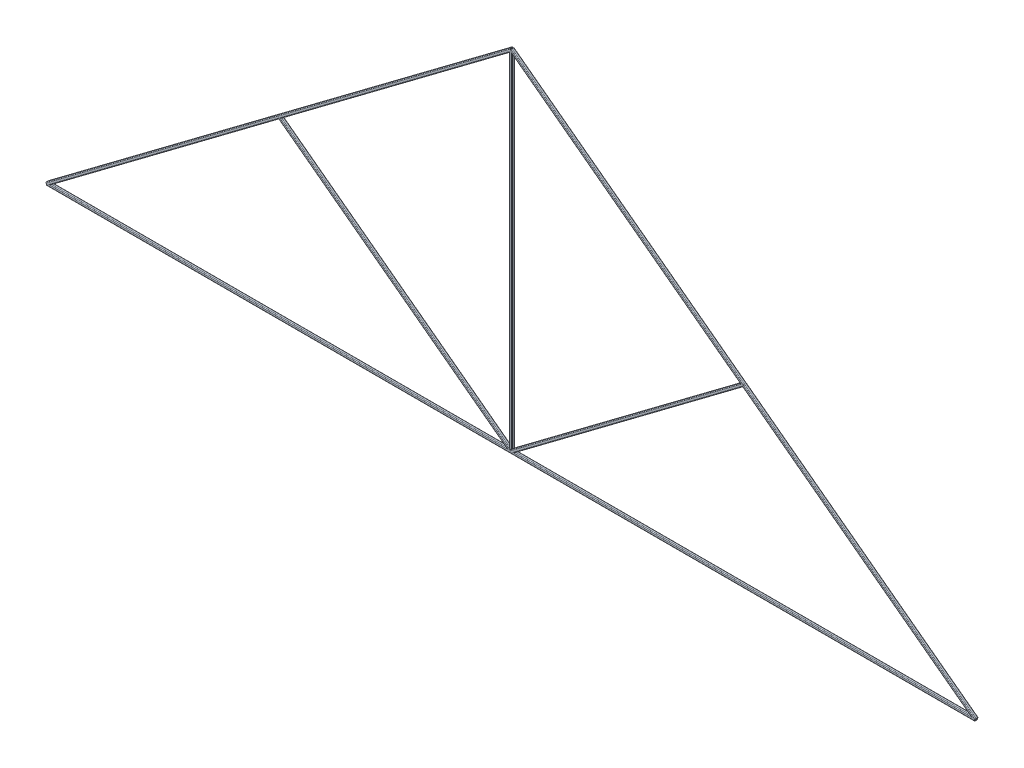
from build123d import *

# Parameters (mm, degrees)
STRUCTURAL_MEMBER1_DEPTH   = 5000
STRUCTURAL_MEMBER1_2_DEPTH = 5000
STRUCTURAL_MEMBER1_3_DEPTH = 5000
STRUCTURAL_MEMBER1_4_DEPTH = 5000
STRUCTURAL_MEMBER1_5_DEPTH = 8000
STRUCTURAL_MEMBER1_6_DEPTH = 8000
STRUCTURAL_START           = 31.75
STRUCTURAL_MEMBER2_DEPTH   = 5968.25
STRUCTURAL_START_2         = -26
STRUCTURAL_MEMBER2_2_DEPTH = 52
STRUCTURAL_START_3         = 6400
STRUCTURAL_MEMBER2_3_DEPTH = 5000
STRUCTURAL_START_4         = 1400
STRUCTURAL_MEMBER2_4_DEPTH = 5000


with BuildPart() as part:
    # Sketch12 → Structural Member1 (new body)
    with BuildSketch(Plane(origin=(0, 0, 0), x_dir=(-0.6000000000000001, 0.7999999999999999, 0), z_dir=(0.7999999999999999, 0.6000000000000001, 0))):
        with BuildLine():
            Line((-12.7, -25.4), (12.7, -25.4))
            ThreePointArc((12.7, -25.4), (21.680256121, -21.680256121), (25.4, -12.7))
            Line((25.4, -12.7), (25.4, 12.7))
            ThreePointArc((25.4, 12.7), (21.680256121, 21.680256121), (12.7, 25.4))
            Line((12.7, 25.4), (-12.7, 25.4))
            ThreePointArc((-12.7, 25.4), (-21.680256121, 21.680256121), (-25.4, 12.7))
            Line((-25.4, 12.7), (-25.4, -12.7))
            ThreePointArc((-25.4, -12.7), (-21.680256121, -21.680256121), (-12.7, -25.4))
        make_face()
        with BuildLine():
            Line((-12.7, -19.05), (12.7, -19.05))
            ThreePointArc((12.7, -19.05), (17.190128061, -17.190128061), (19.05, -12.7))
            Line((19.05, -12.7), (19.05, 12.7))
            ThreePointArc((19.05, 12.7), (17.190128061, 17.190128061), (12.7, 19.05))
            Line((12.7, 19.05), (-12.7, 19.05))
            ThreePointArc((-12.7, 19.05), (-17.190128061, 17.190128061), (-19.05, 12.7))
            Line((-19.05, 12.7), (-19.05, -12.7))
            ThreePointArc((-19.05, -12.7), (-17.190128061, -17.190128061), (-12.7, -19.05))
        make_face(mode=Mode.SUBTRACT)
    extrude(amount=STRUCTURAL_MEMBER1_DEPTH)


with BuildPart() as body_2:
    # Sketch12 on segment 2 (carried to segment 2) → Structural Member1 2 (new body)
    with BuildSketch(Plane(origin=(4000, 3000, 0), x_dir=(-0.6, 0.8, 0), z_dir=(0.8, 0.6, 0))):
        with BuildLine():
            Line((-12.7, -25.4), (12.7, -25.4))
            ThreePointArc((12.7, -25.4), (21.680256121, -21.680256121), (25.4, -12.7))
            Line((25.4, -12.7), (25.4, 12.7))
            ThreePointArc((25.4, 12.7), (21.680256121, 21.680256121), (12.7, 25.4))
            Line((12.7, 25.4), (-12.7, 25.4))
            ThreePointArc((-12.7, 25.4), (-21.680256121, 21.680256121), (-25.4, 12.7))
            Line((-25.4, 12.7), (-25.4, -12.7))
            ThreePointArc((-25.4, -12.7), (-21.680256121, -21.680256121), (-12.7, -25.4))
        make_face()
        with BuildLine():
            Line((-12.7, -19.05), (12.7, -19.05))
            ThreePointArc((12.7, -19.05), (17.190128061, -17.190128061), (19.05, -12.7))
            Line((19.05, -12.7), (19.05, 12.7))
            ThreePointArc((19.05, 12.7), (17.190128061, 17.190128061), (12.7, 19.05))
            Line((12.7, 19.05), (-12.7, 19.05))
            ThreePointArc((-12.7, 19.05), (-17.190128061, 17.190128061), (-19.05, 12.7))
            Line((-19.05, 12.7), (-19.05, -12.7))
            ThreePointArc((-19.05, -12.7), (-17.190128061, -17.190128061), (-12.7, -19.05))
        make_face(mode=Mode.SUBTRACT)
    extrude(amount=STRUCTURAL_MEMBER1_2_DEPTH)


with BuildPart() as body_3:
    # Sketch12 on segment 3 (carried to segment 3) → Structural Member1 3 (new body)
    with BuildSketch(Plane(origin=(8000, 6000, 0), x_dir=(0.6, 0.8, 0), z_dir=(0.8, -0.6, 0))):
        with BuildLine():
            Line((-12.7, -25.4), (12.7, -25.4))
            ThreePointArc((12.7, -25.4), (21.680256121, -21.680256121), (25.4, -12.7))
            Line((25.4, -12.7), (25.4, 12.7))
            ThreePointArc((25.4, 12.7), (21.680256121, 21.680256121), (12.7, 25.4))
            Line((12.7, 25.4), (-12.7, 25.4))
            ThreePointArc((-12.7, 25.4), (-21.680256121, 21.680256121), (-25.4, 12.7))
            Line((-25.4, 12.7), (-25.4, -12.7))
            ThreePointArc((-25.4, -12.7), (-21.680256121, -21.680256121), (-12.7, -25.4))
        make_face()
        with BuildLine():
            Line((-12.7, -19.05), (12.7, -19.05))
            ThreePointArc((12.7, -19.05), (17.190128061, -17.190128061), (19.05, -12.7))
            Line((19.05, -12.7), (19.05, 12.7))
            ThreePointArc((19.05, 12.7), (17.190128061, 17.190128061), (12.7, 19.05))
            Line((12.7, 19.05), (-12.7, 19.05))
            ThreePointArc((-12.7, 19.05), (-17.190128061, 17.190128061), (-19.05, 12.7))
            Line((-19.05, 12.7), (-19.05, -12.7))
            ThreePointArc((-19.05, -12.7), (-17.190128061, -17.190128061), (-12.7, -19.05))
        make_face(mode=Mode.SUBTRACT)
    extrude(amount=STRUCTURAL_MEMBER1_3_DEPTH)


with BuildPart() as body_4:
    # Sketch12 on segment 4 (carried to segment 4) → Structural Member1 4 (new body)
    with BuildSketch(Plane(origin=(12000, 3000, 0), x_dir=(0.6, 0.8, 0), z_dir=(0.8, -0.6, 0))):
        with BuildLine():
            Line((-12.7, -25.4), (12.7, -25.4))
            ThreePointArc((12.7, -25.4), (21.680256121, -21.680256121), (25.4, -12.7))
            Line((25.4, -12.7), (25.4, 12.7))
            ThreePointArc((25.4, 12.7), (21.680256121, 21.680256121), (12.7, 25.4))
            Line((12.7, 25.4), (-12.7, 25.4))
            ThreePointArc((-12.7, 25.4), (-21.680256121, 21.680256121), (-25.4, 12.7))
            Line((-25.4, 12.7), (-25.4, -12.7))
            ThreePointArc((-25.4, -12.7), (-21.680256121, -21.680256121), (-12.7, -25.4))
        make_face()
        with BuildLine():
            Line((-12.7, -19.05), (12.7, -19.05))
            ThreePointArc((12.7, -19.05), (17.190128061, -17.190128061), (19.05, -12.7))
            Line((19.05, -12.7), (19.05, 12.7))
            ThreePointArc((19.05, 12.7), (17.190128061, 17.190128061), (12.7, 19.05))
            Line((12.7, 19.05), (-12.7, 19.05))
            ThreePointArc((-12.7, 19.05), (-17.190128061, 17.190128061), (-19.05, 12.7))
            Line((-19.05, 12.7), (-19.05, -12.7))
            ThreePointArc((-19.05, -12.7), (-17.190128061, -17.190128061), (-12.7, -19.05))
        make_face(mode=Mode.SUBTRACT)
    extrude(amount=STRUCTURAL_MEMBER1_4_DEPTH)


with BuildPart() as body_5:
    # Sketch12 on segment 5 (carried to segment 5) → Structural Member1 5 (new body)
    with BuildSketch(Plane(origin=(16000, 0, 0), x_dir=(0, -1, 0), z_dir=(-1, 0, 0))):
        with BuildLine():
            Line((-12.7, -25.4), (12.7, -25.4))
            ThreePointArc((12.7, -25.4), (21.680256121, -21.680256121), (25.4, -12.7))
            Line((25.4, -12.7), (25.4, 12.7))
            ThreePointArc((25.4, 12.7), (21.680256121, 21.680256121), (12.7, 25.4))
            Line((12.7, 25.4), (-12.7, 25.4))
            ThreePointArc((-12.7, 25.4), (-21.680256121, 21.680256121), (-25.4, 12.7))
            Line((-25.4, 12.7), (-25.4, -12.7))
            ThreePointArc((-25.4, -12.7), (-21.680256121, -21.680256121), (-12.7, -25.4))
        make_face()
        with BuildLine():
            Line((-12.7, -19.05), (12.7, -19.05))
            ThreePointArc((12.7, -19.05), (17.190128061, -17.190128061), (19.05, -12.7))
            Line((19.05, -12.7), (19.05, 12.7))
            ThreePointArc((19.05, 12.7), (17.190128061, 17.190128061), (12.7, 19.05))
            Line((12.7, 19.05), (-12.7, 19.05))
            ThreePointArc((-12.7, 19.05), (-17.190128061, 17.190128061), (-19.05, 12.7))
            Line((-19.05, 12.7), (-19.05, -12.7))
            ThreePointArc((-19.05, -12.7), (-17.190128061, -17.190128061), (-12.7, -19.05))
        make_face(mode=Mode.SUBTRACT)
    extrude(amount=STRUCTURAL_MEMBER1_5_DEPTH)


with BuildPart() as body_6:
    # Sketch12 on segment 6 (carried to segment 6) → Structural Member1 6 (new body)
    with BuildSketch(Plane(origin=(8000, 0, 0), x_dir=(0, -1, 0), z_dir=(-1, 0, 0))):
        with BuildLine():
            Line((-12.7, -25.4), (12.7, -25.4))
            ThreePointArc((12.7, -25.4), (21.680256121, -21.680256121), (25.4, -12.7))
            Line((25.4, -12.7), (25.4, 12.7))
            ThreePointArc((25.4, 12.7), (21.680256121, 21.680256121), (12.7, 25.4))
            Line((12.7, 25.4), (-12.7, 25.4))
            ThreePointArc((-12.7, 25.4), (-21.680256121, 21.680256121), (-25.4, 12.7))
            Line((-25.4, 12.7), (-25.4, -12.7))
            ThreePointArc((-25.4, -12.7), (-21.680256121, -21.680256121), (-12.7, -25.4))
        make_face()
        with BuildLine():
            Line((-12.7, -19.05), (12.7, -19.05))
            ThreePointArc((12.7, -19.05), (17.190128061, -17.190128061), (19.05, -12.7))
            Line((19.05, -12.7), (19.05, 12.7))
            ThreePointArc((19.05, 12.7), (17.190128061, 17.190128061), (12.7, 19.05))
            Line((12.7, 19.05), (-12.7, 19.05))
            ThreePointArc((-12.7, 19.05), (-17.190128061, 17.190128061), (-19.05, 12.7))
            Line((-19.05, 12.7), (-19.05, -12.7))
            ThreePointArc((-19.05, -12.7), (-17.190128061, -17.190128061), (-12.7, -19.05))
        make_face(mode=Mode.SUBTRACT)
    extrude(amount=STRUCTURAL_MEMBER1_6_DEPTH)


with BuildPart() as body_7:
    # Structural Member2: read off the stored shape, not the designer's step
    # Structural Member2 outline → Structural Member2 (new body)
    with BuildSketch(Plane(origin=(0, 0, 0), x_dir=(1, 0, 0), z_dir=(0, 1, 0)).offset(STRUCTURAL_START)):
        with BuildLine():
            Line((7974.6, 12.7), (7974.6, -12.7))
            ThreePointArc((7974.6, -12.7), (7978.319743879, -21.680256121), (7987.3, -25.4))
            Line((7987.3, -25.4), (8012.7, -25.4))
            ThreePointArc((8012.7, -25.4), (8021.680256121, -21.680256121), (8025.4, -12.7))
            Line((8025.4, -12.7), (8025.4, 12.7))
            ThreePointArc((8025.4, 12.7), (8021.680256121, 21.680256121), (8012.7, 25.4))
            Line((8012.7, 25.4), (7987.3, 25.4))
            ThreePointArc((7987.3, 25.4), (7978.319743879, 21.680256121), (7974.6, 12.7))
        make_face()
        with BuildLine():
            ThreePointArc((8012.7, 19.05), (8017.190128061, 17.190128061), (8019.05, 12.7))
            Line((8019.05, 12.7), (8019.05, -12.7))
            ThreePointArc((8019.05, -12.7), (8017.190128061, -17.190128061), (8012.7, -19.05))
            Line((8012.7, -19.05), (7987.3, -19.05))
            ThreePointArc((7987.3, -19.05), (7982.809871939, -17.190128061), (7980.95, -12.7))
            Line((7980.95, -12.7), (7980.95, 12.7))
            ThreePointArc((7980.95, 12.7), (7982.809871939, 17.190128061), (7987.3, 19.05))
            Line((7987.3, 19.05), (8012.7, 19.05))
        make_face(mode=Mode.SUBTRACT)
    extrude(amount=STRUCTURAL_MEMBER2_DEPTH)

    # Structural Member2 2 outline → Structural Member2 2 (cut)
    with BuildSketch(Plane.XY.offset(STRUCTURAL_START_2)):
        Polygon((8000, 31.75), (8025.4, 31.75), (8025.4, 50.8), align=None)
        Polygon((7974.6, 50.8), (7974.6, 31.75), (8000, 31.75), align=None)
    extrude(amount=STRUCTURAL_MEMBER2_2_DEPTH, mode=Mode.SUBTRACT)


with BuildPart() as body_8:
    # Structural Member2 3 outline → Structural Member2 3 (new body)
    with BuildSketch(Plane(origin=(0, 0, 0), x_dir=(0.6, -0.8000000000000002, 0), z_dir=(0.8, 0.6, 0)).offset(STRUCTURAL_START_3)):
        with BuildLine():
            ThreePointArc((4774.6, -12.7), (4778.319743879, -21.680256121), (4787.3, -25.4))
            Line((4787.3, -25.4), (4812.7, -25.4))
            ThreePointArc((4812.7, -25.4), (4821.680256121, -21.680256121), (4825.4, -12.7))
            Line((4825.4, -12.7), (4825.4, 12.7))
            ThreePointArc((4825.4, 12.7), (4821.680256121, 21.680256121), (4812.7, 25.4))
            Line((4812.7, 25.4), (4787.3, 25.4))
            ThreePointArc((4787.3, 25.4), (4778.319743879, 21.680256121), (4774.6, 12.7))
            Line((4774.6, 12.7), (4774.6, -12.7))
        make_face()
        with BuildLine():
            Line((4819.05, 12.7), (4819.05, -12.7))
            ThreePointArc((4819.05, -12.7), (4817.190128061, -17.190128061), (4812.7, -19.05))
            Line((4812.7, -19.05), (4787.3, -19.05))
            ThreePointArc((4787.3, -19.05), (4782.809871939, -17.190128061), (4780.95, -12.7))
            Line((4780.95, -12.7), (4780.95, 12.7))
            ThreePointArc((4780.95, 12.7), (4782.809871939, 17.190128061), (4787.3, 19.05))
            Line((4787.3, 19.05), (4812.7, 19.05))
            ThreePointArc((4812.7, 19.05), (4817.190128061, 17.190128061), (4819.05, 12.7))
        make_face(mode=Mode.SUBTRACT)
    extrude(amount=STRUCTURAL_MEMBER2_3_DEPTH)


with BuildPart() as body_9:
    # Structural Member2 4 outline → Structural Member2 4 (new body)
    with BuildSketch(Plane(origin=(0, 0, 0), x_dir=(0.6, 0.8000000000000002, 0), z_dir=(0.8, -0.6, 0)).offset(STRUCTURAL_START_4)):
        with BuildLine():
            ThreePointArc((4825.4, 12.7), (4821.680256121, 21.680256121), (4812.7, 25.4))
            Line((4812.7, 25.4), (4787.3, 25.4))
            ThreePointArc((4787.3, 25.4), (4778.319743879, 21.680256121), (4774.6, 12.7))
            Line((4774.6, 12.7), (4774.6, -12.7))
            ThreePointArc((4774.6, -12.7), (4778.319743879, -21.680256121), (4787.3, -25.4))
            Line((4787.3, -25.4), (4812.7, -25.4))
            ThreePointArc((4812.7, -25.4), (4821.680256121, -21.680256121), (4825.4, -12.7))
            Line((4825.4, -12.7), (4825.4, 12.7))
        make_face()
        with BuildLine():
            Line((4780.95, -12.7), (4780.95, 12.7))
            ThreePointArc((4780.95, 12.7), (4782.809871939, 17.190128061), (4787.3, 19.05))
            Line((4787.3, 19.05), (4812.7, 19.05))
            ThreePointArc((4812.7, 19.05), (4817.190128061, 17.190128061), (4819.05, 12.7))
            Line((4819.05, 12.7), (4819.05, -12.7))
            ThreePointArc((4819.05, -12.7), (4817.190128061, -17.190128061), (4812.7, -19.05))
            Line((4812.7, -19.05), (4787.3, -19.05))
            ThreePointArc((4787.3, -19.05), (4782.809871939, -17.190128061), (4780.95, -12.7))
        make_face(mode=Mode.SUBTRACT)
    extrude(amount=STRUCTURAL_MEMBER2_4_DEPTH)


solid = Compound([part.part, body_2.part, body_3.part, body_4.part, body_5.part, body_6.part, body_7.part, body_8.part, body_9.part])
